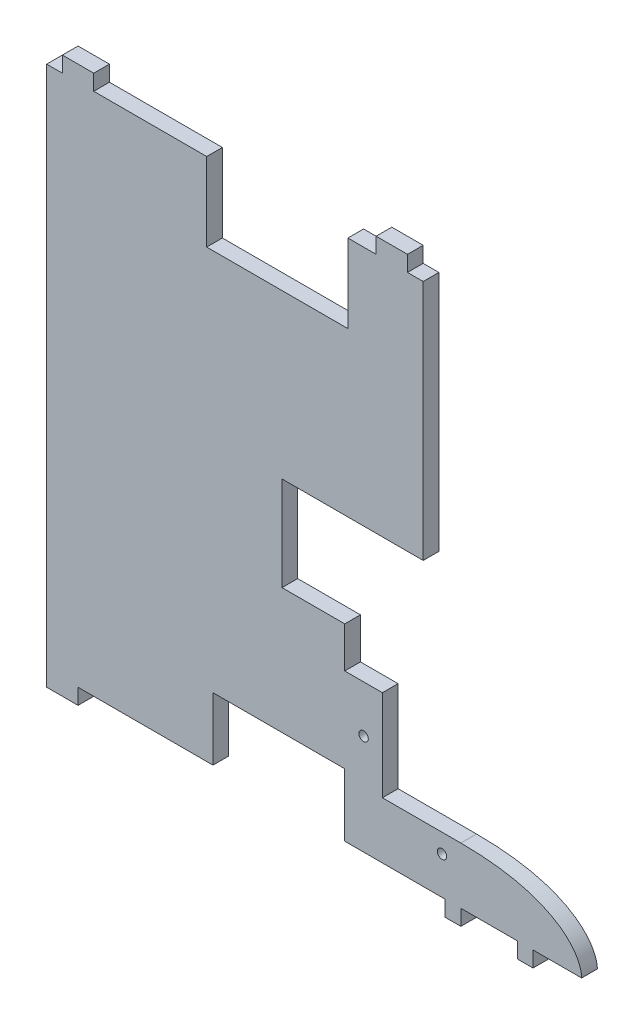
from build123d import *

# Parameters (mm, degrees)
ESQUISSE1_R        = 1.5
BOSS_EXTRU_1_DEPTH = 5
BOSS_EXTRU_2_DEPTH = 5


with BuildPart() as part:
    # Esquisse1 → Boss.-Extru.1 (new body)
    with BuildSketch(Plane.XY):
        Polygon((0, 0), (32, 0), (32, -5), (37, -5), (37, 0), (37, 18), (12, 18), (12, 47), (0, 47), align=None)
        with Locations((6, 32)):
            Circle(ESQUISSE1_R, mode=Mode.SUBTRACT)
        with Locations((31, 12)):
            Circle(ESQUISSE1_R, mode=Mode.SUBTRACT)
    extrude(amount=BOSS_EXTRU_1_DEPTH)

    # Esquisse2 → Boss.-Extru.2 (add)
    with BuildSketch(Plane(origin=(0, 0, 0), x_dir=(-1, 0, 0), z_dir=(0, 0, -1))):
        with BuildLine():
            Line((-37, 0), (-55, 0))
            Line((-55, 0), (-55, -5))
            Line((-55, -5), (-60, -5))
            Line((-60, -5), (-60, 0))
            Line((-60, 0), (-75.5, 0))
            add(Edge.make_bspline(
                [(-75.5, 0), (-75.5, 5.982232529), (-67.685409636, 18), (-37, 18)],
                knots=[0, 0, 0, 0, 1, 1, 1, 1], degree=3))
            Line((-37, 18), (-37, 0))
        make_face()
        Polygon((42, 0), (85, 0), (85, -5), (95, -5), (95, 167), (90, 167), (90, 172), (80, 172), (80, 167), (44, 167), (44, 142), (-1, 142), (-1, 167), (-10, 167), (-10, 172), (-20, 172), (-20, 167), (-25, 167), (-25, 90), (20, 90), (20, 60), (0, 60), (0, 20), (42, 20), align=None)
    extrude(amount=-BOSS_EXTRU_2_DEPTH)


solid = part.part
